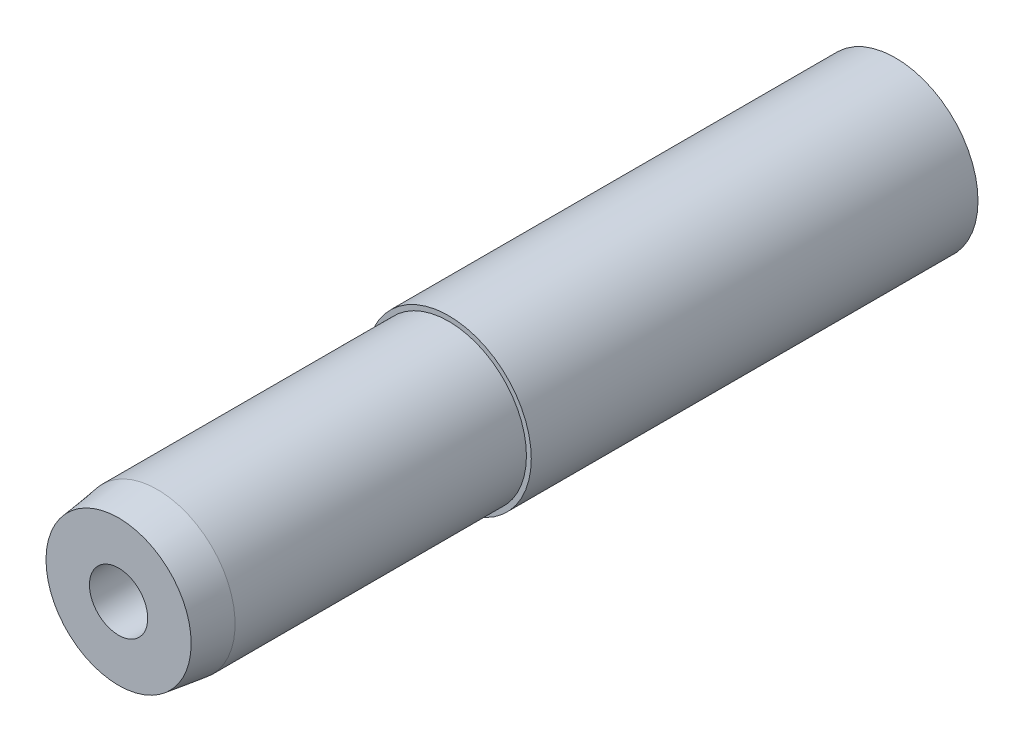
from build123d import *

# Parameters (mm, degrees)
SKETCH1_R                 = 8.5
BOSS_EXTRUDE1_DEPTH       = 46
SKETCH2_R                 = 8
BOSS_EXTRUDE2_DEPTH       = 34
CUT_EXTRUDE1_DEPTH        = 81.898084032
CUT_EXTRUDE1_DEPTH_BACK   = 81.898084032
SKETCH3_W                 = 2.5
SKETCH3_H                 = 25.25
FILLET1_R                 = 1
F_6_0MM_DOWEL_HOLE1_D     = 6
F_6_0MM_DOWEL_HOLE1_DEPTH = 32.197418143
F_6_0MM_DOWEL_HOLE1_TIP   = 1.802581857


with BuildPart() as part:
    # Sketch1 → Boss-Extrude1 (new body)
    with BuildSketch(Plane.XY):
        Circle(SKETCH1_R)
    extrude(amount=BOSS_EXTRUDE1_DEPTH)

    # Sketch2 → Boss-Extrude2 (add)
    with BuildSketch(Plane.XY.offset(46)):
        Circle(SKETCH2_R)
    extrude(amount=BOSS_EXTRUDE2_DEPTH)

    # Sketch3 → Cut-Extrude1 (cut, two sides: drawn at the far end of the back side and taken through both)
    with BuildSketch(Plane(origin=(0, 0, 0), x_dir=(1, 0, 0), z_dir=(0, 1, 0)).offset(-CUT_EXTRUDE1_DEPTH_BACK)):
        with Locations((-6.75, -63.625)):
            Rectangle(SKETCH3_W, SKETCH3_H)
    extrude(amount=CUT_EXTRUDE1_DEPTH + CUT_EXTRUDE1_DEPTH_BACK, mode=Mode.SUBTRACT)

    # Fillet1
    fillet1_edges = [part.edges().sort_by_distance(p)[0] for p in [
        (-5.5, 0, 51),
        (-5.5, 0, 76.25),
    ]]
    fillet(fillet1_edges, radius=FILLET1_R)

    # Chamfer1: read off the stored shape, not the designer's step
    # Chamfer1 outline → Chamfer1 (revolve, cut)
    with BuildSketch(Plane.XZ):
        Polygon((8, 80), (7.47339001, 80), (8, 76), align=None)
    revolve(axis=Axis((0, 0, 0), (0, 0, 1)), mode=Mode.SUBTRACT)

    # Ø6.0mm Dowel Hole1
    with Locations(Plane.XY.offset(80)):
        with Locations((0, 0)):
            Hole(F_6_0MM_DOWEL_HOLE1_D / 2, depth=F_6_0MM_DOWEL_HOLE1_DEPTH)
            with Locations((0, 0, -(F_6_0MM_DOWEL_HOLE1_DEPTH + F_6_0MM_DOWEL_HOLE1_TIP / 2))):  # 118° drill point
                Cone(0, F_6_0MM_DOWEL_HOLE1_D / 2, F_6_0MM_DOWEL_HOLE1_TIP, mode=Mode.SUBTRACT)


solid = part.part
